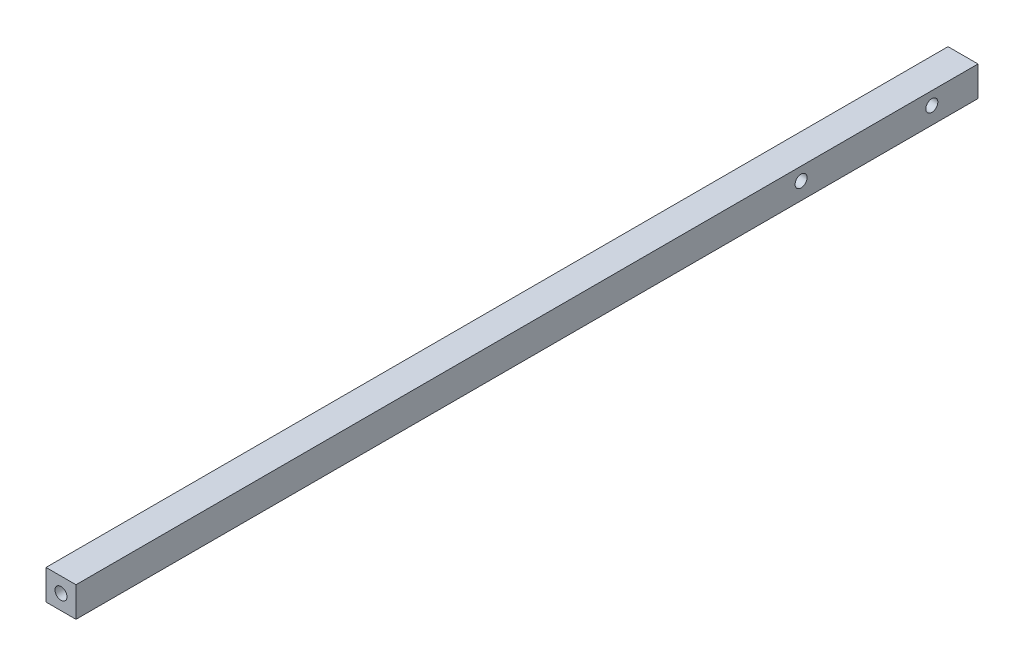
from build123d import *

# Parameters (mm, degrees)
ESQUISSE1_W             = 10
ESQUISSE1_H             = 10
BOSS_EXTRU_1_DEPTH      = 300.81
ESQUISSE2_R             = 2
ENL_V_MAT_EXTRU_1_DEPTH = 302.142252266
ESQUISSE3_R             = 2
ENL_V_MAT_EXTRU_2_DEPTH = 6
ENL_V_START             = -6
ESQUISSE4_R             = 2
ENL_V_MAT_EXTRU_3_DEPTH = 6


with BuildPart() as part:
    # Esquisse1 → Boss.-Extru.1 (new body)
    with BuildSketch(Plane.XY):
        with Locations((5, 5)):
            Rectangle(ESQUISSE1_W, ESQUISSE1_H)
    extrude(amount=BOSS_EXTRU_1_DEPTH)

    # Esquisse2 → Enlèv. mat.-Extru.1 (cut, through all)
    with BuildSketch(Plane.ZY):
        with Locations((15.4, 5.7)):
            Circle(ESQUISSE2_R)
        with Locations((59, 5.7)):
            Circle(ESQUISSE2_R)
    extrude(amount=-ENL_V_MAT_EXTRU_1_DEPTH, mode=Mode.SUBTRACT)

    # Esquisse3 → Enlèv. mat.-Extru.2 (cut)
    with BuildSketch(Plane(origin=(0, 0, 0), x_dir=(-1, 0, 0), z_dir=(0, 0, -1))):
        with Locations((-5, 5)):
            Circle(ESQUISSE3_R)
    extrude(amount=-ENL_V_MAT_EXTRU_2_DEPTH, mode=Mode.SUBTRACT)

    # Esquisse4 → Enlèv. mat.-Extru.3 (cut)
    with BuildSketch(Plane.XY.offset(300.81).offset(ENL_V_START)):
        with Locations((5, 5)):
            Circle(ESQUISSE4_R)
    extrude(amount=ENL_V_MAT_EXTRU_3_DEPTH, mode=Mode.SUBTRACT)


solid = part.part
